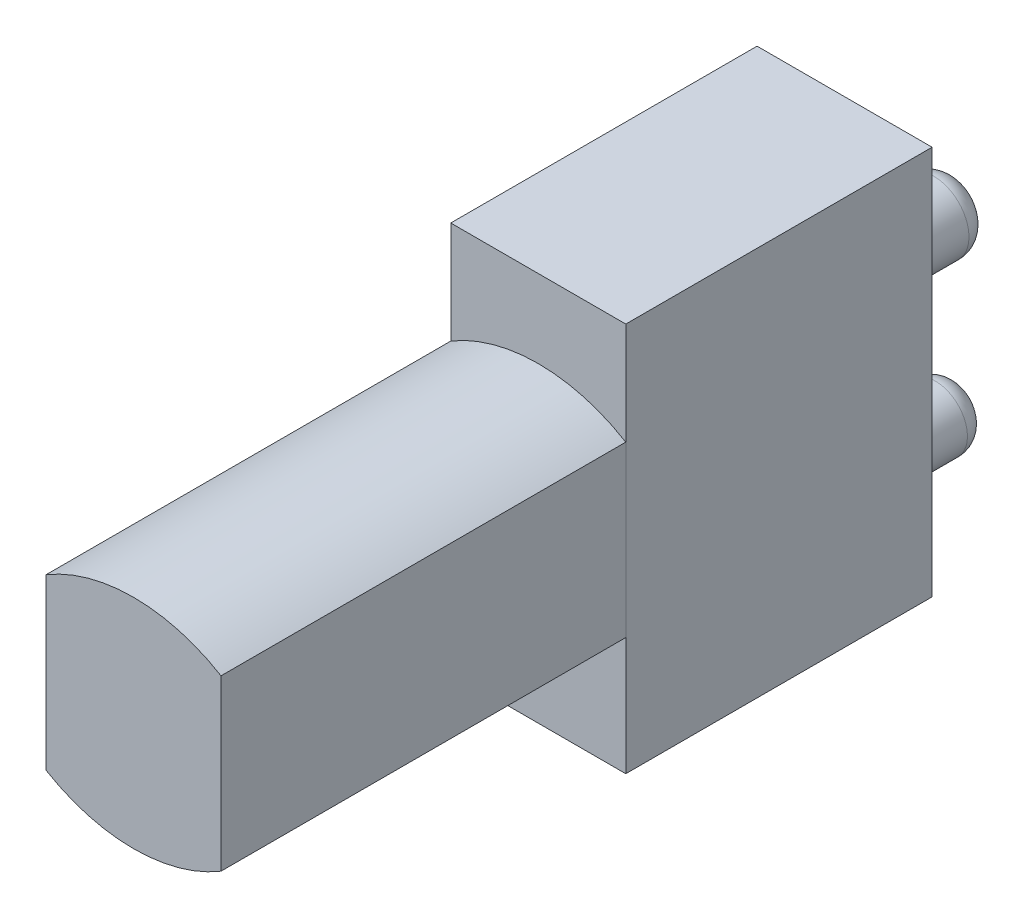
from build123d import *

# Parameters (mm, degrees)
SKETCH1_W           = 8
SKETCH1_H           = 17.8
BOSS_EXTRUDE1_DEPTH = 14
BOSS_EXTRUDE2_DEPTH = 18.5
SKETCH3_R           = 1.455112434
SKETCH3_R_2         = 0.997349366
SKETCH3_R_3         = 1.6
SKETCH3_R_4         = 1.003096482
BOSS_EXTRUDE3_DEPTH = 5
FILLET1_R           = 1


with BuildPart() as part:
    # Sketch1 → Boss-Extrude1 (new body)
    with BuildSketch(Plane.XY):
        with Locations((-4.001754105, -0.359172607)):
            Rectangle(SKETCH1_W, SKETCH1_H)
    extrude(amount=BOSS_EXTRUDE1_DEPTH)

    # Sketch3 → Boss-Extrude3 (add)
    # profile 1 of 2: a face of its own
    with BuildSketch(Plane(origin=(0, 0, 0), x_dir=(-1, 0, 0), z_dir=(0, 0, -1))):
        with Locations((4.001754105, -6.25552787)):
            Circle(SKETCH3_R)
        with Locations((4.001754105, -6.25552787)):
            Circle(SKETCH3_R_2, mode=Mode.SUBTRACT)
    # profile 2 of 2: a face of its own
    with BuildSketch(Plane(origin=(0, 0, 0), x_dir=(-1, 0, 0), z_dir=(0, 0, -1))):
        with Locations((4.001754105, 1.747298107)):
            Circle(SKETCH3_R_3)
        with Locations((4.001754105, 1.747298107)):
            Circle(SKETCH3_R_4, mode=Mode.SUBTRACT)
    extrude(amount=BOSS_EXTRUDE3_DEPTH)

    # Fillet1
    # the kernel refuses this fillet: 1 mm, written as the material it takes off along each edge
    with BuildSketch(Plane(origin=(-4.001754105, -6.25552787, -5), x_dir=(-1, 0, 0), z_dir=(0, -1, 0))) as fillet1_piece_1:
        with BuildLine():
            CenterArc((0.455112434, -0.84022563), FILLET1_R, 0, 57.163953249)
            Line((0.997349366, 0), (1.008194105, 0.016804513))
            ThreePointArc((1.008194105, 0.016804513), (1.2262309, 0.02), (1.455112434, 0.02))
            Line((1.455112434, 0.02), (1.475112434, 0))
            Line((1.475112434, 0), (1.475112434, -0.84022563))
            Line((1.475112434, -0.84022563), (1.455112434, -0.84022563))
        make_face()
    revolve(axis=Axis((-4.001754105, -6.25552787, -5), (0, 0, -1)), mode=Mode.SUBTRACT)
    with BuildSketch(Plane(origin=(-4.001754105, 1.747298107, -5), x_dir=(-1, 0, 0), z_dir=(0, -1, 0))) as fillet1_piece_2:
        with BuildLine():
            CenterArc((0.6, -0.915157487), FILLET1_R, 0, 66.22810219)
            Line((1.003096482, 0), (1.011158412, 0.01830315))
            ThreePointArc((1.011158412, 0.01830315), (1.301548241, 0.02), (1.6, 0.02))
            Line((1.6, 0.02), (1.62, 0))
            Line((1.62, 0), (1.62, -0.915157487))
            Line((1.62, -0.915157487), (1.6, -0.915157487))
        make_face()
    revolve(axis=Axis((-4.001754105, 1.747298107, -5), (0, 0, -1)), mode=Mode.SUBTRACT)


with BuildPart() as body_2:
    # Sketch2 → Boss-Extrude2 (new body)
    with BuildSketch(Plane.XY.offset(14)):
        with BuildLine():
            Line((-8.001754105, -3.867150267), (-8.001754105, 3.867150267))
            ThreePointArc((-8.001754105, 3.867150267), (-4.001754105, 4.977137227), (-0.001754105, 3.867150267))
            Line((-0.001754105, 3.867150267), (-0.001754105, -3.867150267))
            ThreePointArc((-0.001754105, -3.867150267), (-4.001754105, -4.977137227), (-8.001754105, -3.867150267))
        make_face()
    extrude(amount=BOSS_EXTRUDE2_DEPTH)


solid = Compound([part.part, body_2.part])
